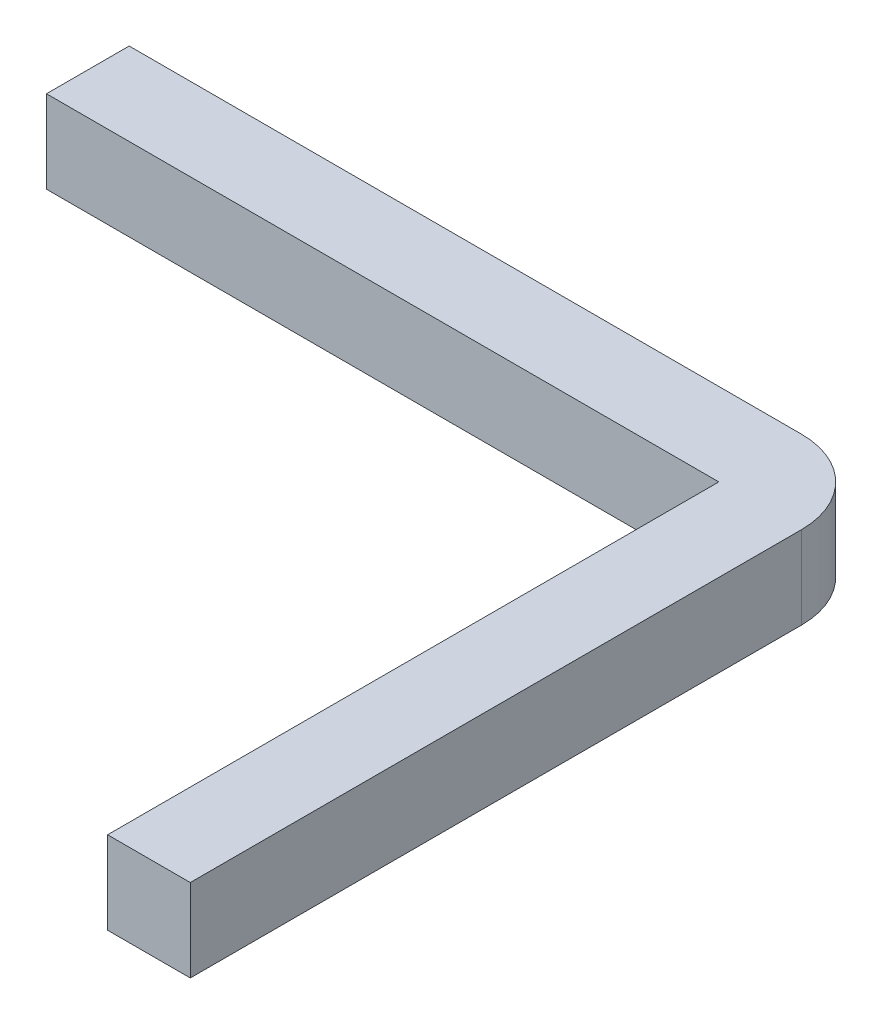
from build123d import *

# Parameters (mm, degrees)
CROQUIS1_W              = 210
CROQUIS1_H              = 23
SALIENTE_EXTRUIR2_DEPTH = 23
REDONDEO4_R             = 23
CROQUIS2_W              = 23
CROQUIS2_H              = 23
SALIENTE_EXTRUIR3_DEPTH = 170
CROQUIS8_W              = 19
CROQUIS8_H              = 19
CORTAR_EXTRUIR2_DEPTH   = 80


with BuildPart() as part:
    # Croquis1 → Saliente-Extruir2 (new body)
    with BuildSketch(Plane.XY):
        Rectangle(CROQUIS1_W, CROQUIS1_H)
    extrude(amount=SALIENTE_EXTRUIR2_DEPTH)

    # Redondeo4
    redondeo4_edges = [part.edges().sort_by_distance(p)[0] for p in [
        (105, 0, 0),
    ]]
    fillet(redondeo4_edges, radius=REDONDEO4_R - 0.0001)  # a hair under: the kernel refuses the full size

    # Croquis2 → Saliente-Extruir3 (add)
    with BuildSketch(Plane.XY.offset(23)):
        with Locations((93.5, 0)):
            Rectangle(CROQUIS2_W, CROQUIS2_H)
    extrude(amount=SALIENTE_EXTRUIR3_DEPTH)

    # Croquis8 → Cortar-Extruir2 (cut)
    with BuildSketch(Plane.ZY.offset(105)):
        with Locations((11.435856313, 0)):
            Rectangle(CROQUIS8_W, CROQUIS8_H)
    extrude(amount=-CORTAR_EXTRUIR2_DEPTH, mode=Mode.SUBTRACT)


solid = part.part
